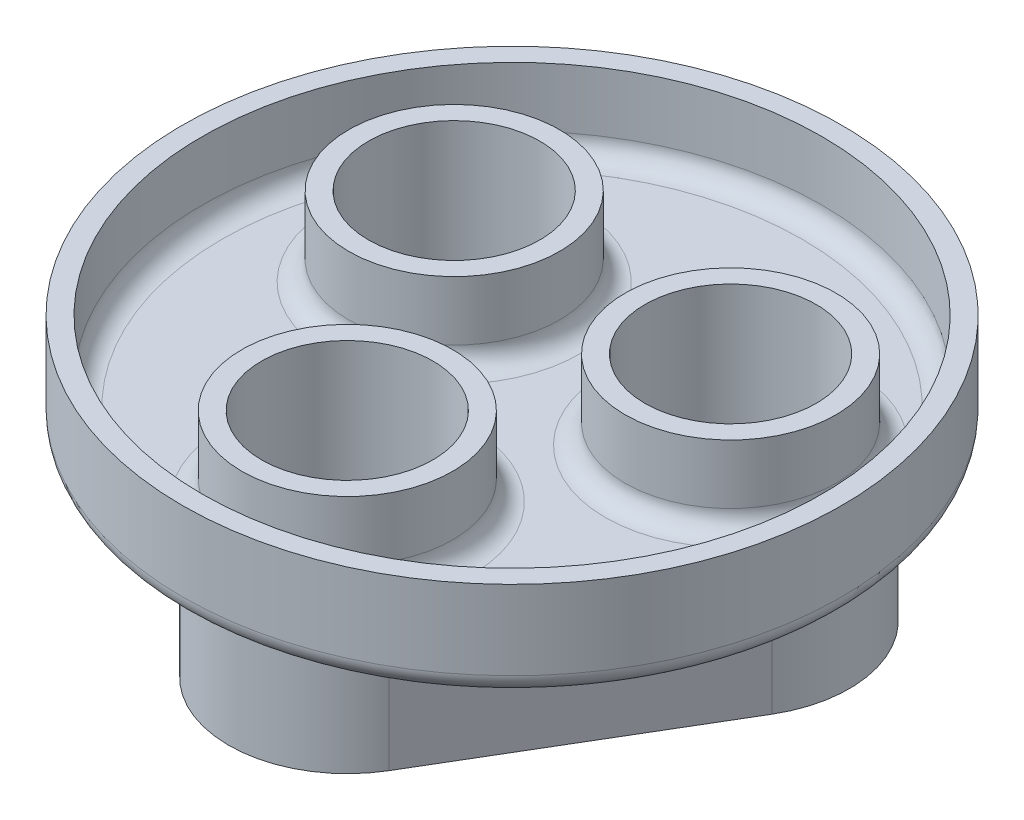
from build123d import *

# Parameters (mm, degrees)
SKETCH1_R           = 50
SKETCH1_R_2         = 13
BOSS_EXTRUDE1_DEPTH = 15
BOSS_EXTRUDE3_START = -20
SKETCH1_5_R         = 13
BOSS_EXTRUDE3_DEPTH = 20
SHELL1_START        = 3
SHELL1_OUTLINE_R    = 47
SHELL1_OUTLINE_R_2  = 16
SHELL1_DEPTH        = 12
SHELL1_START_2      = -17
SHELL1_2_DEPTH      = 20
FILLET3_R           = 3
FILLET4_R           = 3
FILLET5_R           = 3
SKETCH1_7_R         = 13
BOSS_EXTRUDE4_DEPTH = 3
FILLET6_R           = 3
FILLET7_R           = 3
FILLET8_R           = 3
FILLET9_R           = 3


# Read off the part's stored shape, not the designer's step: Shell1
with BuildPart() as part:
    # Sketch1 → Boss-Extrude1 (new body)
    # profile 1 of 3: a face of its own
    with BuildSketch(Plane(origin=(0, 0, 0), x_dir=(1, 0, 0), z_dir=(0, 1, 0))):
        with Locations(Location((0, 0, 0), (0, 0, 270))):
            Circle(SKETCH1_R)
        with BuildLine():
            ThreePointArc((-15.693411867, -33.815714604), (-0.212073133, -42.998750651), (15.481338733, -34.183036046))
            Line((15.481338733, -34.183036046), (37.131973828, 2.316963954))
            ThreePointArc((37.131973828, 2.316963954), (37.344046961, 20.315714604), (21.862708228, 29.498750651))
            Line((21.862708228, 29.498750651), (-20.572536557, 29.998750651))
            ThreePointArc((-20.572536557, 29.998750651), (-36.265948424, 21.183036046), (-36.478021557, 3.184285396))
            Line((-36.478021557, 3.184285396), (-15.693411867, -33.815714604))
        make_face(mode=Mode.SUBTRACT)
    # profile 2 of 3: a face of its own
    with BuildSketch(Plane(origin=(0, 0, 0), x_dir=(1, 0, 0), z_dir=(0, 1, 0))):
        with BuildLine():
            Line((-15.693411867, -33.815714604), (-36.478021557, 3.184285396))
            ThreePointArc((-36.478021557, 3.184285396), (-36.265948424, 21.183036046), (-20.572536557, 29.998750651))
            Line((-20.572536557, 29.998750651), (21.862708228, 29.498750651))
            ThreePointArc((21.862708228, 29.498750651), (37.344046961, 20.315714604), (37.131973828, 2.316963954))
            Line((37.131973828, 2.316963954), (15.481338733, -34.183036046))
            ThreePointArc((15.481338733, -34.183036046), (-0.212073133, -42.998750651), (-15.693411867, -33.815714604))
        make_face()
        with Locations(Location((-20.784609691, 12, 0), (0, 0, 270))):
            Circle(SKETCH1_R_2, mode=Mode.SUBTRACT)
        with Locations(Location((21.650635095, 11.5, 0), (0, 0, 270))):
            Circle(SKETCH1_R_2, mode=Mode.SUBTRACT)
        with Locations(Location((0, -25, 0), (0, 0, 270))):
            Circle(SKETCH1_R_2, mode=Mode.SUBTRACT)
        with BuildLine():
            ThreePointArc((-5.877984665, 26.825401524), (-8.607603848, 25.145037444), (-8.261426951, 21.958408209))
            ThreePointArc((-8.261426951, 21.958408209), (-7.023419706, 3.837301292), (-23.519456803, -3.764536507))
            ThreePointArc((-23.519456803, -3.764536507), (-26.481910808, -4.988591486), (-26.647809281, -8.189672869))
            Line((-26.647809281, -8.189672869), (-20.292486854, -19.503184805))
            ThreePointArc((-20.292486854, -19.503184805), (-17.472439282, -21.02692232), (-14.885825861, -19.133809716))
            ThreePointArc((-14.885825861, -19.133809716), (0.188509452, -9.001110533), (15.01991265, -19.486178822))
            ThreePointArc((15.01991265, -19.486178822), (17.56120236, -21.439711757), (20.416369394, -19.982843358))
            Line((20.416369394, -19.982843358), (27.036496923, -8.822216719))
            ThreePointArc((27.036496923, -8.822216719), (26.946068533, -5.618115124), (24.013278215, -4.324598494))
            ThreePointArc((24.013278215, -4.324598494), (7.700935658, 3.663809241), (9.365569557, 21.750715328))
            ThreePointArc((9.365569557, 21.750715328), (9.786733851, 24.928303244), (7.097465291, 26.672516227))
            Line((7.097465291, 26.672516227), (-5.877984665, 26.825401524))
        make_face(mode=Mode.SUBTRACT)
    # profile 3 of 3: a face of its own
    with BuildSketch(Plane(origin=(0, 0, 0), x_dir=(1, 0, 0), z_dir=(0, 1, 0))):
        with BuildLine():
            Line((-5.877984665, 26.825401524), (7.097465291, 26.672516227))
            ThreePointArc((7.097465291, 26.672516227), (9.786733851, 24.928303244), (9.365569557, 21.750715328))
            ThreePointArc((9.365569557, 21.750715328), (7.700935658, 3.663809241), (24.013278215, -4.324598494))
            ThreePointArc((24.013278215, -4.324598494), (26.946068533, -5.618115124), (27.036496923, -8.822216719))
            Line((27.036496923, -8.822216719), (20.416369394, -19.982843358))
            ThreePointArc((20.416369394, -19.982843358), (17.56120236, -21.439711757), (15.01991265, -19.486178822))
            ThreePointArc((15.01991265, -19.486178822), (0.188509452, -9.001110533), (-14.885825861, -19.133809716))
            ThreePointArc((-14.885825861, -19.133809716), (-17.472439282, -21.02692232), (-20.292486854, -19.503184805))
            Line((-20.292486854, -19.503184805), (-26.647809281, -8.189672869))
            ThreePointArc((-26.647809281, -8.189672869), (-26.481910808, -4.988591486), (-23.519456803, -3.764536507))
            ThreePointArc((-23.519456803, -3.764536507), (-7.023419706, 3.837301292), (-8.261426951, 21.958408209))
            ThreePointArc((-8.261426951, 21.958408209), (-8.607603848, 25.145037444), (-5.877984665, 26.825401524))
        make_face()
    extrude(amount=BOSS_EXTRUDE1_DEPTH)

    # Sketch1<5> → Boss-Extrude3 (add)
    with BuildSketch(Plane(origin=(0, 0, 0), x_dir=(1, 0, 0), z_dir=(0, 1, 0)).offset(BOSS_EXTRUDE3_START)):
        with BuildLine():
            Line((-15.693411867, -33.815714604), (-36.478021557, 3.184285396))
            ThreePointArc((-36.478021557, 3.184285396), (-36.265948424, 21.183036046), (-20.572536557, 29.998750651))
            Line((-20.572536557, 29.998750651), (21.862708228, 29.498750651))
            ThreePointArc((21.862708228, 29.498750651), (37.344046961, 20.315714604), (37.131973828, 2.316963954))
            Line((37.131973828, 2.316963954), (15.481338733, -34.183036046))
            ThreePointArc((15.481338733, -34.183036046), (-0.212073133, -42.998750651), (-15.693411867, -33.815714604))
        make_face()
        with Locations(Location((-20.784609691, 12, 0), (0, 0, 270))):
            Circle(SKETCH1_5_R, mode=Mode.SUBTRACT)
        with Locations(Location((21.650635095, 11.5, 0), (0, 0, 270))):
            Circle(SKETCH1_5_R, mode=Mode.SUBTRACT)
        with Locations(Location((0, -25, 0), (0, 0, 270))):
            Circle(SKETCH1_5_R, mode=Mode.SUBTRACT)
        with BuildLine():
            ThreePointArc((-5.877984665, 26.825401524), (-8.607603848, 25.145037444), (-8.261426951, 21.958408209))
            ThreePointArc((-8.261426951, 21.958408209), (-7.023419706, 3.837301292), (-23.519456803, -3.764536507))
            ThreePointArc((-23.519456803, -3.764536507), (-26.481910808, -4.988591486), (-26.647809281, -8.189672869))
            Line((-26.647809281, -8.189672869), (-20.292486854, -19.503184805))
            ThreePointArc((-20.292486854, -19.503184805), (-17.472439282, -21.02692232), (-14.885825861, -19.133809716))
            ThreePointArc((-14.885825861, -19.133809716), (0.188509452, -9.001110533), (15.01991265, -19.486178822))
            ThreePointArc((15.01991265, -19.486178822), (17.56120236, -21.439711757), (20.416369394, -19.982843358))
            Line((20.416369394, -19.982843358), (27.036496923, -8.822216719))
            ThreePointArc((27.036496923, -8.822216719), (26.946068533, -5.618115124), (24.013278215, -4.324598494))
            ThreePointArc((24.013278215, -4.324598494), (7.700935658, 3.663809241), (9.365569557, 21.750715328))
            ThreePointArc((9.365569557, 21.750715328), (9.786733851, 24.928303244), (7.097465291, 26.672516227))
            Line((7.097465291, 26.672516227), (-5.877984665, 26.825401524))
        make_face(mode=Mode.SUBTRACT)
    extrude(amount=BOSS_EXTRUDE3_DEPTH)

    # Shell1 outline → Shell1 (cut)
    with BuildSketch(Plane(origin=(0, 0, 0), x_dir=(1, 0, 0), z_dir=(0, 1, 0)).offset(SHELL1_START)):
        Circle(SHELL1_OUTLINE_R)
        with Locations((-20.784609691, 12)):
            Circle(SHELL1_OUTLINE_R_2, mode=Mode.SUBTRACT)
        with Locations((0, -25)):
            Circle(SHELL1_OUTLINE_R_2, mode=Mode.SUBTRACT)
        with Locations((21.650635095, 11.5)):
            Circle(SHELL1_OUTLINE_R_2, mode=Mode.SUBTRACT)
    extrude(amount=SHELL1_DEPTH, mode=Mode.SUBTRACT)

    # Shell1 2 outline → Shell1 2 (cut)
    with BuildSketch(Plane(origin=(0, 0, 0), x_dir=(1, 0, 0), z_dir=(0, 1, 0)).offset(SHELL1_START_2)):
        with BuildLine():
            ThreePointArc((-15.040504166, 26.933360363), (-13.346092405, 26.165749559), (-11.752224337, 25.206665545))
            ThreePointArc((-11.752224337, 25.206665545), (-11.476776556, 26.07239957), (-11.073776432, 26.886621764))
            Line((-11.073776432, 26.886621764), (-15.040504166, 26.933360363))
        make_face()
        with BuildLine():
            ThreePointArc((-29.192686881, -3.659375086), (-28.671373939, -2.915332279), (-28.043700248, -2.258527423))
            ThreePointArc((-28.043700248, -2.258527423), (-29.64954915, -1.319641451), (-31.135573935, -0.200718799))
            Line((-31.135573935, -0.200718799), (-29.192686881, -3.659375086))
        make_face()
        with BuildLine():
            Line((-17.747609254, -24.033482588), (-15.8047222, -27.492138875))
            ThreePointArc((-15.8047222, -27.492138875), (-15.987157625, -25.640929843), (-15.953500538, -23.781057599))
            ThreePointArc((-15.953500538, -23.781057599), (-16.840972087, -23.975379836), (-17.747609254, -24.033482588))
        make_face()
        with BuildLine():
            ThreePointArc((15.977792248, -24.157293119), (15.967617596, -26.017442048), (15.741614547, -27.863838589))
            Line((15.741614547, -27.863838589), (17.765455227, -24.451920901))
            ThreePointArc((17.765455227, -24.451920901), (16.860438784, -24.372472053), (15.977792248, -24.157293119))
        make_face()
        with BuildLine():
            ThreePointArc((28.571750279, -2.925607946), (29.183774047, -3.597019734), (29.687411089, -4.353139176))
            Line((29.687411089, -4.353139176), (31.71125177, -0.941221488))
            ThreePointArc((31.71125177, -0.941221488), (30.199275433, -2.024819716), (28.571750279, -2.925607946))
        make_face()
        with BuildLine():
            ThreePointArc((12.293257058, 26.611295987), (12.676960559, 25.787804333), (12.931933404, 24.915820543))
            ThreePointArc((12.931933404, 24.915820543), (14.547956958, 25.8370835), (16.259984792, 26.564557389))
            Line((16.259984792, 26.564557389), (12.293257058, 26.611295987))
        make_face()
    extrude(amount=SHELL1_2_DEPTH, mode=Mode.SUBTRACT)

    # Fillet3
    fillet3_edges = [part.edges().sort_by_distance(p)[0] for p in [
        (0, 0, -50),
    ]]
    fillet(fillet3_edges, radius=FILLET3_R)

    # Fillet4
    fillet4_edges = [part.edges().sort_by_distance(p)[0] for p in [
        (-26.085716712, 0, 15.315714604),
        (0.645085835, 0, -29.748750651),
        (-0.212073133, 0, 42.998750651),
        (26.306656281, 0, 15.933036046),
        (37.344046961, 0, -20.315714604),
        (-36.265948424, 0, -21.183036046),
    ]]
    fillet(fillet4_edges, radius=FILLET4_R)

    # Fillet5
    fillet5_edges = [part.edges().sort_by_distance(p)[0] for p in [
        (-8.607603848, 0, -25.145037444),
        (-26.481910808, 0, 4.988591486),
        (17.56120236, 0, 21.439711757),
        (23.726433158, 0, 14.402530039),
        (26.946068533, 0, 5.618115124),
        (9.786733851, 0, -24.928303244),
        (0.609740313, 0, -26.748958876),
        (7.700935658, 0, -3.663809241),
        (0.188509452, 0, 9.001110533),
        (-17.472439282, 0, 21.02692232),
        (-23.470148068, 0, 13.846428837),
        (-7.023419706, 0, -3.837301292),
    ]]
    fillet(fillet5_edges, radius=FILLET5_R)

    # Sketch1<7> → Boss-Extrude4 (add)
    with BuildSketch(Plane(origin=(0, 0, 0), x_dir=(1, 0, 0), z_dir=(0, 1, 0))):
        with BuildLine():
            Line((-15.693411867, -33.815714604), (-36.478021557, 3.184285396))
            ThreePointArc((-36.478021557, 3.184285396), (-36.265948424, 21.183036046), (-20.572536557, 29.998750651))
            Line((-20.572536557, 29.998750651), (21.862708228, 29.498750651))
            ThreePointArc((21.862708228, 29.498750651), (37.344046961, 20.315714604), (37.131973828, 2.316963954))
            Line((37.131973828, 2.316963954), (15.481338733, -34.183036046))
            ThreePointArc((15.481338733, -34.183036046), (-0.212073133, -42.998750651), (-15.693411867, -33.815714604))
        make_face()
        with Locations(Location((-20.784609691, 12, 0), (0, 0, 270))):
            Circle(SKETCH1_7_R, mode=Mode.SUBTRACT)
        with Locations(Location((21.650635095, 11.5, 0), (0, 0, 270))):
            Circle(SKETCH1_7_R, mode=Mode.SUBTRACT)
        with Locations(Location((0, -25, 0), (0, 0, 270))):
            Circle(SKETCH1_7_R, mode=Mode.SUBTRACT)
        with BuildLine():
            ThreePointArc((-5.877984665, 26.825401524), (-8.607603848, 25.145037444), (-8.261426951, 21.958408209))
            ThreePointArc((-8.261426951, 21.958408209), (-7.023419706, 3.837301292), (-23.519456803, -3.764536507))
            ThreePointArc((-23.519456803, -3.764536507), (-26.481910808, -4.988591486), (-26.647809281, -8.189672869))
            Line((-26.647809281, -8.189672869), (-20.292486854, -19.503184805))
            ThreePointArc((-20.292486854, -19.503184805), (-17.472439282, -21.02692232), (-14.885825861, -19.133809716))
            ThreePointArc((-14.885825861, -19.133809716), (0.188509452, -9.001110533), (15.01991265, -19.486178822))
            ThreePointArc((15.01991265, -19.486178822), (17.56120236, -21.439711757), (20.416369394, -19.982843358))
            Line((20.416369394, -19.982843358), (27.036496923, -8.822216719))
            ThreePointArc((27.036496923, -8.822216719), (26.946068533, -5.618115124), (24.013278215, -4.324598494))
            ThreePointArc((24.013278215, -4.324598494), (7.700935658, 3.663809241), (9.365569557, 21.750715328))
            ThreePointArc((9.365569557, 21.750715328), (9.786733851, 24.928303244), (7.097465291, 26.672516227))
            Line((7.097465291, 26.672516227), (-5.877984665, 26.825401524))
        make_face(mode=Mode.SUBTRACT)
    extrude(amount=BOSS_EXTRUDE4_DEPTH)

    # Fillet6
    fillet6_edges = [part.edges().sort_by_distance(p)[0] for p in [
        (1.249888954, 3, 40.951105843),
    ]]
    fillet(fillet6_edges, radius=FILLET6_R)

    # Fillet7
    fillet7_edges = [part.edges().sort_by_distance(p)[0] for p in [
        (7.700935658, 3, -3.663809241),
    ]]
    fillet(fillet7_edges, radius=FILLET7_R)

    # Fillet8
    fillet8_edges = [part.edges().sort_by_distance(p)[0] for p in [
        (-12.422356673, 3, 1.640847644),
    ]]
    fillet(fillet8_edges, radius=FILLET8_R)

    # Fillet9
    fillet9_edges = [part.edges().sort_by_distance(p)[0] for p in [
        (-47, 3, 0),
    ]]
    fillet(fillet9_edges, radius=FILLET9_R - 0.0001)  # a hair under: the kernel refuses the full size


solid = part.part
